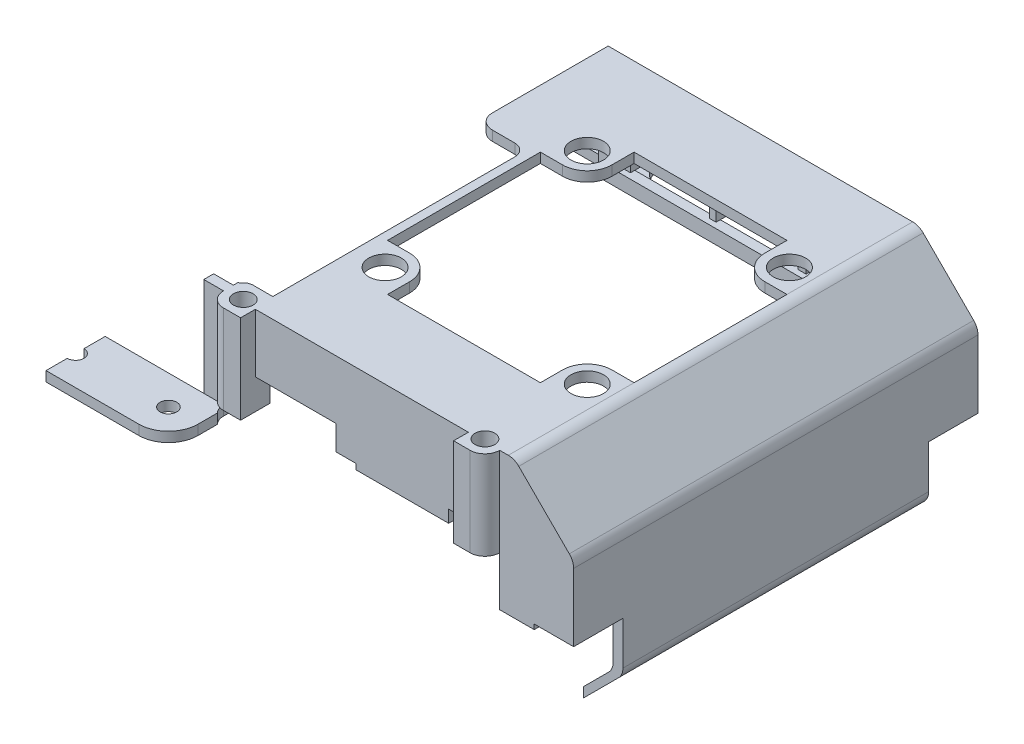
from build123d import *

# Parameters (mm, degrees)
EXTRUDE_1_DEPTH     = 82
FILLET_1_R          = 3
EXTRUDE_START       = -2
EXTRUDE_2_DEPTH     = 2
EXTRUDE_START_2     = -82
EXTRUDE_3_DEPTH     = 2
CUT_EXTRUDE_1_DEPTH = 2
CUT_EXTRUDE_2_DEPTH = 2
CUT_EXTRUDE_3_REACH = 114.805
SKETCH_7_R          = 2
SKETCH_7_R_2        = 3.3
SKETCH_8_R          = 2
EXTRUDE_4_DEPTH     = 18
SKETCH_9_W          = 7
SKETCH_9_H          = 20
EXTRUDE_5_DEPTH     = 2
SKETCH_10_W         = 2
SKETCH_10_H         = 20
EXTRUDE_6_DEPTH     = 1
SKETCH_11_W         = 7
SKETCH_11_H         = 20
EXTRUDE_7_DEPTH     = 2
SKETCH_12_W         = 10
SKETCH_12_H         = 22
CUT_EXTRUDE_4_DEPTH = 8
SKETCH_13_W         = 10
SKETCH_13_H         = 82
CUT_EXTRUDE_5_DEPTH = 21
SKETCH_14_R         = 1.7
EXTRUDE_8_DEPTH     = 2


with BuildPart() as part:
    # 草图1 → 凸台-拉伸1 (new body)
    with BuildSketch(Plane.XY):
        Polygon((0, 0), (0, 2), (3, 2), (13, 12), (13, 37), (3, 47), (-60, 47), (-60, 49), (3, 49), (15, 37), (15, 12), (3, 0), align=None)
    extrude(amount=EXTRUDE_1_DEPTH)

    # 圆角1
    fillet_1_edges = [part.edges().sort_by_distance(p)[0] for p in [
        (3, 0, 41),
        (15, 12, 41),
        (15, 37, 41),
        (3, 49, 41),
        (3, 2, 41),
        (13, 12, 41),
        (13, 37, 41),
        (3, 47, 41),
    ]]
    fillet(fillet_1_edges, radius=FILLET_1_R)

    # 草图4 → 凸台-拉伸2 (add)
    with BuildSketch(Plane(origin=(0, 0, 0), x_dir=(-1, 0, 0), z_dir=(0, 0, -1)).offset(EXTRUDE_START)):
        with BuildLine():
            Line((0, 0), (0, 26))
            Line((0, 26), (4, 26))
            Line((4, 26), (4, 27))
            Line((4, 27), (60, 27))
            Line((60, 27), (60, 49))
            Line((60, 49), (-1.757359313, 49))
            ThreePointArc((-1.757359313, 49), (-2.90540961, 48.771638598), (-3.878679656, 48.121320344))
            Line((-3.878679656, 48.121320344), (-14.121320344, 37.878679656))
            ThreePointArc((-14.121320344, 37.878679656), (-14.771638598, 36.90540961), (-15, 35.757359313))
            Line((-15, 35.757359313), (-15, 13.242640687))
            ThreePointArc((-15, 13.242640687), (-14.771638598, 12.09459039), (-14.121320344, 11.121320344))
            Line((-14.121320344, 11.121320344), (-3.878679656, 0.878679656))
            ThreePointArc((-3.878679656, 0.878679656), (-2.90540961, 0.228361402), (-1.757359313, 0))
            Line((-1.757359313, 0), (0, 0))
        make_face()
    extrude(amount=EXTRUDE_2_DEPTH)

    # 草图4<2> → 凸台-拉伸3 (add)
    with BuildSketch(Plane(origin=(0, 0, 0), x_dir=(-1, 0, 0), z_dir=(0, 0, -1)).offset(EXTRUDE_START_2)):
        with BuildLine():
            Line((0, 0), (0, 26))
            Line((0, 26), (4, 26))
            Line((4, 26), (4, 27))
            Line((4, 27), (60, 27))
            Line((60, 27), (60, 49))
            Line((60, 49), (-1.757359313, 49))
            ThreePointArc((-1.757359313, 49), (-2.90540961, 48.771638598), (-3.878679656, 48.121320344))
            Line((-3.878679656, 48.121320344), (-14.121320344, 37.878679656))
            ThreePointArc((-14.121320344, 37.878679656), (-14.771638598, 36.90540961), (-15, 35.757359313))
            Line((-15, 35.757359313), (-15, 13.242640687))
            ThreePointArc((-15, 13.242640687), (-14.771638598, 12.09459039), (-14.121320344, 11.121320344))
            Line((-14.121320344, 11.121320344), (-3.878679656, 0.878679656))
            ThreePointArc((-3.878679656, 0.878679656), (-2.90540961, 0.228361402), (-1.757359313, 0))
            Line((-1.757359313, 0), (0, 0))
        make_face()
    extrude(amount=EXTRUDE_3_DEPTH)

    # 草图5 → 切除-拉伸1 (cut)
    with BuildSketch(Plane(origin=(0, 0, 0), x_dir=(-1, 0, 0), z_dir=(0, 0, -1))):
        Polygon((2.661599935, 45.0208), (2.661599935, 31), (0, 31), (0, 29.863095934), (55.9999896, 29.863095934), (55.9999896, 31), (53.469479015, 31), (53.469479015, 44.2999988), (37.469480535, 44.2999988), (37.469480535, 31), (36.113001155, 31), (36.113001155, 38.112), (19.512998795, 38.112), (19.512998795, 31), (17.861600015, 31), (17.861600015, 45.0208), align=None)
    extrude(amount=-CUT_EXTRUDE_1_DEPTH, mode=Mode.SUBTRACT)

    # 草图6 → 切除-拉伸2 (cut)
    with BuildSketch(Plane.XY.offset(82)):
        Polygon((-55.9999896, 31), (-49.543385864, 31), (-49.543385864, 37.1214), (-33.143393264, 37.1214), (-33.143393264, 32.1214), (-29.143393264, 32.1214), (-29.143393264, 31), (-10.34416017, 31), (-10.34416017, 33.50000008), (-6.34416055, 33.50000008), (-6.34416055, 31), (0, 31), (0, 27), (0, 26), (-4, 26), (-4, 27), (-55.9999896, 27), align=None)
    extrude(amount=-CUT_EXTRUDE_2_DEPTH, mode=Mode.SUBTRACT)

    # 草图7 → 切除-拉伸3 (cut, up to next)
    with BuildSketch(Plane(origin=(0, 49, 0), x_dir=(1, 0, 0), z_dir=(0, 1, 0)), mode=Mode.PRIVATE) as cut_extrude_3_sk1:
        with Locations((-52.4947896, -81.4948)):
            Circle(SKETCH_7_R)
    cut_extrude_3_tool1 = extrude(cut_extrude_3_sk1.sketch, amount=-CUT_EXTRUDE_3_REACH, mode=Mode.PRIVATE) & part.part
    # 草图7 → 切除-拉伸3 (cut, up to next)
    with BuildSketch(Plane(origin=(0, 49, 0), x_dir=(1, 0, 0), z_dir=(0, 1, 0)), mode=Mode.PRIVATE) as cut_extrude_3_sk2:
        with Locations((-3.4981896, -81.4948)):
            Circle(SKETCH_7_R)
    cut_extrude_3_tool2 = extrude(cut_extrude_3_sk2.sketch, amount=-CUT_EXTRUDE_3_REACH, mode=Mode.PRIVATE) & part.part
    # 草图7 → 切除-拉伸3 (cut, up to next)
    with BuildSketch(Plane(origin=(0, 49, 0), x_dir=(1, 0, 0), z_dir=(0, 1, 0)), mode=Mode.PRIVATE) as cut_extrude_3_sk3:
        with Locations((-43.742640687, -20.5)):
            Circle(SKETCH_7_R_2)
    cut_extrude_3_tool3 = extrude(cut_extrude_3_sk3.sketch, amount=-CUT_EXTRUDE_3_REACH, mode=Mode.PRIVATE) & part.part
    # 草图7 → 切除-拉伸3 (cut, up to next)
    with BuildSketch(Plane(origin=(0, 49, 0), x_dir=(1, 0, 0), z_dir=(0, 1, 0)), mode=Mode.PRIVATE) as cut_extrude_3_sk4:
        with Locations((-2.742640687, -20.5)):
            Circle(SKETCH_7_R_2)
    cut_extrude_3_tool4 = extrude(cut_extrude_3_sk4.sketch, amount=-CUT_EXTRUDE_3_REACH, mode=Mode.PRIVATE) & part.part
    # 草图7 → 切除-拉伸3 (cut, up to next)
    with BuildSketch(Plane(origin=(0, 49, 0), x_dir=(1, 0, 0), z_dir=(0, 1, 0)), mode=Mode.PRIVATE) as cut_extrude_3_sk5:
        with Locations((-2.742640687, -61.5)):
            Circle(SKETCH_7_R_2)
    cut_extrude_3_tool5 = extrude(cut_extrude_3_sk5.sketch, amount=-CUT_EXTRUDE_3_REACH, mode=Mode.PRIVATE) & part.part
    # 草图7 → 切除-拉伸3 (cut, up to next)
    with BuildSketch(Plane(origin=(0, 49, 0), x_dir=(1, 0, 0), z_dir=(0, 1, 0)), mode=Mode.PRIVATE) as cut_extrude_3_sk6:
        with Locations((-43.742640687, -61.5)):
            Circle(SKETCH_7_R_2)
    cut_extrude_3_tool6 = extrude(cut_extrude_3_sk6.sketch, amount=-CUT_EXTRUDE_3_REACH, mode=Mode.PRIVATE) & part.part
    # 草图7 → 切除-拉伸3 (cut, up to next)
    with BuildSketch(Plane(origin=(0, 49, 0), x_dir=(1, 0, 0), z_dir=(0, 1, 0)), mode=Mode.PRIVATE) as cut_extrude_3_sk7:
        with BuildLine():
            Line((-50, -66), (-50, -78))
            Line((-50, -78), (-53.9999896, -78))
            ThreePointArc((-53.9999896, -78), (-55.414203162, -78.585786438), (-55.9999896, -80))
            Line((-55.9999896, -80), (-60, -80))
            Line((-60, -80), (-60, -23.494789))
            ThreePointArc((-60, -23.494789), (-59.121320344, -25.616109344), (-57, -26.494789))
            Line((-57, -26.494789), (-52.436945771, -26.494789))
            ThreePointArc((-52.436945771, -26.494789), (-50.713764891, -27.208553891), (-50, -28.931734771))
            Line((-50, -28.931734771), (-50, -41))
            Line((-50, -41), (-50, -66))
        make_face()
    cut_extrude_3_tool7 = extrude(cut_extrude_3_sk7.sketch, amount=-CUT_EXTRUDE_3_REACH, mode=Mode.PRIVATE) & part.part
    # 草图7 → 切除-拉伸3 (cut, up to next)
    with BuildSketch(Plane(origin=(0, 49, 0), x_dir=(1, 0, 0), z_dir=(0, 1, 0)), mode=Mode.PRIVATE) as cut_extrude_3_sk8:
        with BuildLine():
            Line((-38.742640687, -20.5), (-38.742640687, -16))
            Line((-38.742640687, -16), (-7.742640687, -16))
            Line((-7.742640687, -16), (-7.742640687, -20.5))
            ThreePointArc((-7.742640687, -20.5), (-6.278174593, -24.035533906), (-2.742640687, -25.5))
            Line((-2.742640687, -25.5), (1.757359313, -25.5))
            Line((1.757359313, -25.5), (1.757359313, -56.5))
            Line((1.757359313, -56.5), (-2.742640687, -56.5))
            ThreePointArc((-2.742640687, -56.5), (-6.278174593, -57.964466094), (-7.742640687, -61.5))
            Line((-7.742640687, -61.5), (-7.742640687, -66))
            Line((-7.742640687, -66), (-38.742640687, -66))
            Line((-38.742640687, -66), (-38.742640687, -61.5))
            ThreePointArc((-38.742640687, -61.5), (-40.207106781, -57.964466094), (-43.742640687, -56.5))
            Line((-43.742640687, -56.5), (-48.242640687, -56.5))
            Line((-48.242640687, -56.5), (-48.242640687, -25.5))
            Line((-48.242640687, -25.5), (-43.742640687, -25.5))
            ThreePointArc((-43.742640687, -25.5), (-40.207106781, -24.035533906), (-38.742640687, -20.5))
        make_face()
    cut_extrude_3_tool8 = extrude(cut_extrude_3_sk8.sketch, amount=-CUT_EXTRUDE_3_REACH, mode=Mode.PRIVATE) & part.part
    add(cut_extrude_3_tool1.solids().sort_by_distance((-52.49479, 49, 81.4948))[0], mode=Mode.SUBTRACT)
    add(cut_extrude_3_tool2.solids().sort_by_distance((-3.49819, 49, 81.4948))[0], mode=Mode.SUBTRACT)
    add(cut_extrude_3_tool3.solids().sort_by_distance((-43.742641, 49, 20.5))[0], mode=Mode.SUBTRACT)
    add(cut_extrude_3_tool4.solids().sort_by_distance((-2.742641, 49, 20.5))[0], mode=Mode.SUBTRACT)
    add(cut_extrude_3_tool5.solids().sort_by_distance((-2.742641, 49, 61.5))[0], mode=Mode.SUBTRACT)
    add(cut_extrude_3_tool6.solids().sort_by_distance((-43.742641, 49, 61.5))[0], mode=Mode.SUBTRACT)
    add(cut_extrude_3_tool7.solids().sort_by_distance((-55.073425, 49, 52.662221))[0], mode=Mode.SUBTRACT)
    add(cut_extrude_3_tool8.solids().sort_by_distance((-23.242641, 49, 41))[0], mode=Mode.SUBTRACT)

    # 草图8 → 凸台-拉伸4 (add)
    # profile 1 of 2: a face of its own
    with BuildSketch(Plane(origin=(0, 49, 0), x_dir=(1, 0, 0), z_dir=(0, 1, 0))):
        with BuildLine():
            Line((-6.34416055, -79), (0, -79))
            Line((0, -79), (0, -82))
            ThreePointArc((0, -82), (-0.878677535, -84.121318222), (-2.999994, -85))
            Line((-2.999994, -85), (-6.34416055, -85))
            Line((-6.34416055, -85), (-6.34416055, -82))
            Line((-6.34416055, -82), (-6.34416055, -79))
        make_face()
        with Locations((-3.4981896, -81.4948)):
            Circle(SKETCH_8_R, mode=Mode.SUBTRACT)
    # profile 2 of 2: a face of its own
    with BuildSketch(Plane(origin=(0, 49, 0), x_dir=(1, 0, 0), z_dir=(0, 1, 0))):
        with BuildLine():
            Line((-49.543385864, -82), (-49.543385864, -79))
            Line((-49.543385864, -79), (-55.9999896, -79))
            Line((-55.9999896, -79), (-55.9999896, -82))
            ThreePointArc((-55.9999896, -82), (-55.121313822, -84.12131998), (-52.9999956, -85))
            Line((-52.9999956, -85), (-49.543385856, -85))
            Line((-49.543385856, -85), (-49.543385864, -82))
        make_face()
        with Locations((-52.4947896, -81.4948)):
            Circle(SKETCH_8_R, mode=Mode.SUBTRACT)
    extrude(amount=-EXTRUDE_4_DEPTH)

    # 草图9 → 凸台-拉伸5 (add)
    with BuildSketch(Plane.ZY):
        with Locations((4.5, 11)):
            Rectangle(SKETCH_9_W, SKETCH_9_H)
        with Locations((77.5, 11)):
            Rectangle(SKETCH_9_W, SKETCH_9_H)
    extrude(amount=-EXTRUDE_5_DEPTH)

    # 草图10 → 凸台-拉伸6 (add)
    with BuildSketch(Plane.ZY):
        with Locations((7, 11)):
            Rectangle(SKETCH_10_W, SKETCH_10_H)
        with Locations((75, 11)):
            Rectangle(SKETCH_10_W, SKETCH_10_H)
    extrude(amount=EXTRUDE_6_DEPTH)

    # 草图11 → 凸台-拉伸7 (add)
    with BuildSketch(Plane.ZY.offset(1)):
        with Locations((4.5, 11)):
            Rectangle(SKETCH_11_W, SKETCH_11_H)
        with Locations((77.5, 11)):
            Rectangle(SKETCH_11_W, SKETCH_11_H)
    extrude(amount=EXTRUDE_7_DEPTH)

    # 草图12 → 切除-拉伸4 (cut)
    with BuildSketch(Plane(origin=(15, 0, 0), x_dir=(0, 0, -1), z_dir=(1, 0, 0))):
        with Locations((-77, 11)):
            Rectangle(SKETCH_12_W, SKETCH_12_H)
        with Locations((-5, 11)):
            Rectangle(SKETCH_12_W, SKETCH_12_H)
    extrude(amount=-CUT_EXTRUDE_4_DEPTH, mode=Mode.SUBTRACT)

    # 草图13 → 切除-拉伸5 (cut)
    with BuildSketch(Plane.XZ):
        with Locations((2, 41)):
            Rectangle(SKETCH_13_W, SKETCH_13_H)
    extrude(amount=-CUT_EXTRUDE_5_DEPTH, mode=Mode.SUBTRACT)

    # 草图14 → 凸台-拉伸8 (add)
    # profile 1 of 2: a face of its own
    with BuildSketch(Plane.XZ.offset(-27).offset(EXTRUDE_START)):
        with BuildLine():
            Line((-55.173938425, 0), (-80, 0))
            Line((-80, 0), (-80, -4.3))
            ThreePointArc((-80, -4.3), (-78.3, -6), (-80, -7.7))
            Line((-80, -7.7), (-80, -12))
            Line((-80, -12), (-61.173938425, -12))
            ThreePointArc((-61.173938425, -12), (-56.931297738, -10.242640687), (-55.173938425, -6))
            ThreePointArc((-55.173938425, -6), (-53.416579112, -1.757359313), (-49.173938425, 0))
            Line((-49.173938425, 0), (-55.173938425, 0))
        make_face()
        with Locations((-61.173938425, -6)):
            Circle(SKETCH_14_R, mode=Mode.SUBTRACT)
    # profile 2 of 2: a face of its own
    with BuildSketch(Plane.XZ.offset(-27).offset(EXTRUDE_START)):
        with BuildLine():
            Line((-80, 94), (-61.173938425, 94))
            ThreePointArc((-61.173938425, 94), (-56.931297738, 92.242640687), (-55.173938425, 88))
            Line((-55.173938425, 88), (-55.173938425, 84.067356138))
            ThreePointArc((-55.173938425, 84.067356138), (-55.785834059, 83.113140351), (-55.9999896, 82))
            Line((-55.9999896, 82), (-80, 82))
            Line((-80, 82), (-80, 86.3))
            ThreePointArc((-80, 86.3), (-78.3, 88), (-80, 89.7))
            Line((-80, 89.7), (-80, 94))
        make_face()
        with Locations((-61.173938425, 88)):
            Circle(SKETCH_14_R, mode=Mode.SUBTRACT)
    extrude(amount=EXTRUDE_8_DEPTH)


solid = part.part
